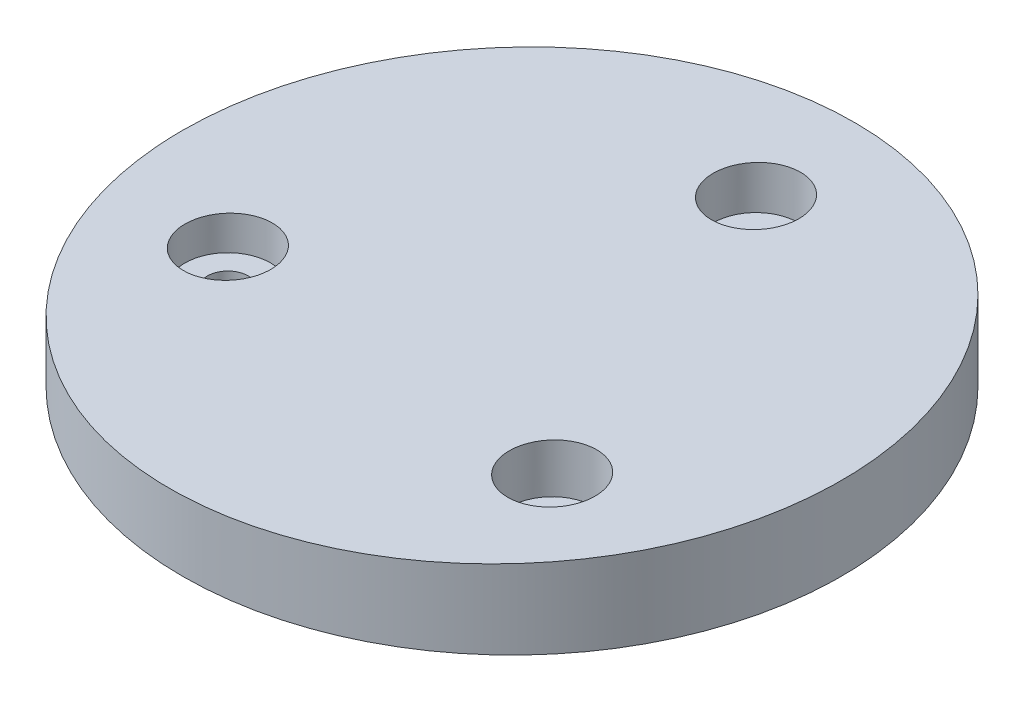
from build123d import *

# Parameters (mm, degrees)
SKETCH1_R                            = 25
BOSS_EXTRUDE1_DEPTH                  = 4.3
BOSS_EXTRUDE2_REACH                  = 37.616
BOSS_EXTRUDE2_END_RADIUS             = 25
BOSS_EXTRUDE2_DIRECTION_2_REACH      = 37.616
BOSS_EXTRUDE2_DIRECTION_2_END_RADIUS = 25
CUT_EXTRUDE1_REACH                   = 37.912
SKETCH3_R                            = 1.55
CUT_EXTRUDE2_REACH                   = 37.616
SKETCH4_R                            = 3.25


with BuildPart() as part:
    # Sketch1 → Boss-Extrude1 (new body)
    with BuildSketch(Plane(origin=(0, 0, 0), x_dir=(1, 0, 0), z_dir=(0, 1, 0))):
        Circle(SKETCH1_R)
    extrude(amount=BOSS_EXTRUDE1_DEPTH)

    # Boss-Extrude2: up to this cylinder (the profile starts inside it)
    boss_extrude2_end = Plane(origin=(0, 4.966667, 0), z_dir=(0, -1, 0)) * Cylinder(BOSS_EXTRUDE2_END_RADIUS, 126.232, mode=Mode.PRIVATE)
    # Sketch2 → Boss-Extrude2 (add, up to the surface)
    with BuildSketch(Plane.XY, mode=Mode.PRIVATE) as boss_extrude2_sk1:
        Polygon((-25, 4.3), (25, 6.3), (25, 4.3), align=None)
    boss_extrude2_tool1 = extrude(boss_extrude2_sk1.sketch, amount=BOSS_EXTRUDE2_REACH, mode=Mode.PRIVATE) & boss_extrude2_end
    add(boss_extrude2_tool1.solids().sort_by_distance((8.333333, 4.966667, 0))[0])

    # Boss-Extrude2 direction 2: up to this cylinder (the profile starts inside it)
    boss_extrude2_direction_2_end = Plane(origin=(0, 4.966667, 0), z_dir=(0, -1, 0)) * Cylinder(BOSS_EXTRUDE2_DIRECTION_2_END_RADIUS, 126.232, mode=Mode.PRIVATE)
    # Sketch2 → Boss-Extrude2 direction 2 (add, up to the surface)
    with BuildSketch(Plane.XY, mode=Mode.PRIVATE) as boss_extrude2_direction_2_sk1:
        Polygon((-25, 4.3), (25, 6.3), (25, 4.3), align=None)
    boss_extrude2_direction_2_tool1 = extrude(boss_extrude2_direction_2_sk1.sketch, amount=-BOSS_EXTRUDE2_DIRECTION_2_REACH, mode=Mode.PRIVATE) & boss_extrude2_direction_2_end
    add(boss_extrude2_direction_2_tool1.solids().sort_by_distance((8.333333, 4.966667, 0))[0])

    # Sketch3 → Cut-Extrude1 (cut, up to next)
    with BuildSketch(Plane(origin=(0, 0, 0), x_dir=(1, 0, 0), z_dir=(0, 1, 0)), mode=Mode.PRIVATE) as cut_extrude1_sk1:
        with Locations((-15.244012286, -6.314276634)):
            Circle(SKETCH3_R)
    cut_extrude1_tool1 = extrude(cut_extrude1_sk1.sketch, amount=CUT_EXTRUDE1_REACH, mode=Mode.PRIVATE) & part.part
    # Sketch3 → Cut-Extrude1 (cut, up to next)
    with BuildSketch(Plane(origin=(0, 0, 0), x_dir=(1, 0, 0), z_dir=(0, 1, 0)), mode=Mode.PRIVATE) as cut_extrude1_sk2:
        with Locations((2.153682172, 16.358840213)):
            Circle(SKETCH3_R)
    cut_extrude1_tool2 = extrude(cut_extrude1_sk2.sketch, amount=CUT_EXTRUDE1_REACH, mode=Mode.PRIVATE) & part.part
    # Sketch3 → Cut-Extrude1 (cut, up to next)
    with BuildSketch(Plane(origin=(0, 0, 0), x_dir=(1, 0, 0), z_dir=(0, 1, 0)), mode=Mode.PRIVATE) as cut_extrude1_sk3:
        with Locations((13.090330115, -10.044563579)):
            Circle(SKETCH3_R)
    cut_extrude1_tool3 = extrude(cut_extrude1_sk3.sketch, amount=CUT_EXTRUDE1_REACH, mode=Mode.PRIVATE) & part.part
    add(cut_extrude1_tool1.solids().sort_by_distance((-15.244012, 0, 6.314277))[0], mode=Mode.SUBTRACT)
    add(cut_extrude1_tool2.solids().sort_by_distance((2.153682, 0, -16.35884))[0], mode=Mode.SUBTRACT)
    add(cut_extrude1_tool3.solids().sort_by_distance((13.09033, 0, 10.044564))[0], mode=Mode.SUBTRACT)

    # Sketch4 → Cut-Extrude2 (cut, up to next)
    with BuildSketch(Plane(origin=(0, 2, 0), x_dir=(-1, 0, 0), z_dir=(0, -1, 0)), mode=Mode.PRIVATE) as cut_extrude2_sk1:
        with Locations((-2.153682172, 16.358840213)):
            Circle(SKETCH4_R)
    cut_extrude2_tool1 = extrude(cut_extrude2_sk1.sketch, amount=-CUT_EXTRUDE2_REACH, mode=Mode.PRIVATE) & part.part
    # Sketch4 → Cut-Extrude2 (cut, up to next)
    with BuildSketch(Plane(origin=(0, 2, 0), x_dir=(-1, 0, 0), z_dir=(0, -1, 0)), mode=Mode.PRIVATE) as cut_extrude2_sk2:
        with Locations((15.244012286, -6.314276634)):
            Circle(SKETCH4_R)
    cut_extrude2_tool2 = extrude(cut_extrude2_sk2.sketch, amount=-CUT_EXTRUDE2_REACH, mode=Mode.PRIVATE) & part.part
    # Sketch4 → Cut-Extrude2 (cut, up to next)
    with BuildSketch(Plane(origin=(0, 2, 0), x_dir=(-1, 0, 0), z_dir=(0, -1, 0)), mode=Mode.PRIVATE) as cut_extrude2_sk3:
        with Locations((-13.090330115, -10.044563579)):
            Circle(SKETCH4_R)
    cut_extrude2_tool3 = extrude(cut_extrude2_sk3.sketch, amount=-CUT_EXTRUDE2_REACH, mode=Mode.PRIVATE) & part.part
    add(cut_extrude2_tool1.solids().sort_by_distance((2.153682, 2, -16.35884))[0], mode=Mode.SUBTRACT)
    add(cut_extrude2_tool2.solids().sort_by_distance((-15.244012, 2, 6.314277))[0], mode=Mode.SUBTRACT)
    add(cut_extrude2_tool3.solids().sort_by_distance((13.09033, 2, 10.044564))[0], mode=Mode.SUBTRACT)


solid = part.part
